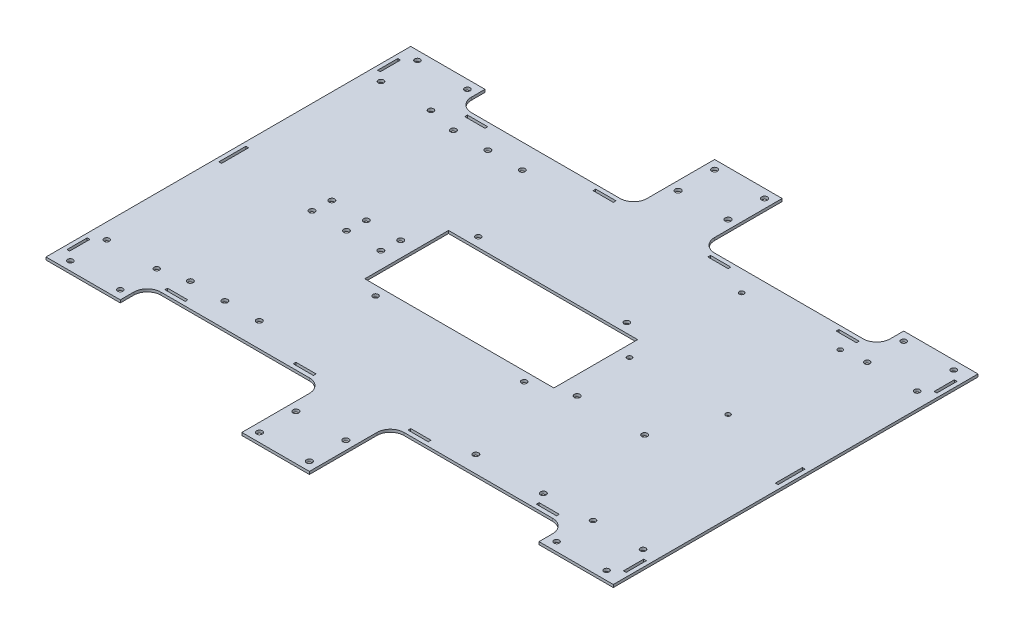
from build123d import *

# Parameters (mm, degrees)
SKETCH_1_R            = 2
SKETCH_1_R_2          = 2.15
EXTRUDE_1_DEPTH       = 2
CUT_EXTRUDE_1_DEPTH   = 274.366054952
MIRROR_2_COPY_1_DEPTH = 274.366054952
SKETCH_3_W            = 2
SKETCH_3_H            = 15
SKETCH_3_H_2          = 20
SKETCH_3_W_2          = 15
SKETCH_3_H_3          = 2
CUT_EXTRUDE_2_DEPTH   = 274.366054952
SKETCH_4_R            = 2.1
SKETCH_4_R_2          = 1.75
CUT_EXTRUDE_3_DEPTH   = 274.366054952
SKETCH_5_R            = 2
SKETCH_5_W            = 140
SKETCH_5_H            = 62
CUT_EXTRUDE_4_DEPTH   = 274.366054952


with BuildPart() as part:
    # 草图1 → 凸台-拉伸1 (new body)
    with BuildSketch(Plane(origin=(0, 0, 0), x_dir=(1, 0, 0), z_dir=(0, 1, 0))):
        Polygon((-210, -135), (-25, -135), (-25, -175), (25, -175), (25, -135), (210, -135), (210, 135), (25, 135), (25, 175), (-25, 175), (-25, 135), (-210, 135), align=None)
        with Locations((198.5, 128.5)):
            Circle(SKETCH_1_R, mode=Mode.SUBTRACT)
        with Locations((198.5, 101.5)):
            Circle(SKETCH_1_R, mode=Mode.SUBTRACT)
        with Locations((161.5, 101.5)):
            Circle(SKETCH_1_R, mode=Mode.SUBTRACT)
        with Locations((161.5, 128.5)):
            Circle(SKETCH_1_R, mode=Mode.SUBTRACT)
        with Locations((198.5, -128.5)):
            Circle(SKETCH_1_R, mode=Mode.SUBTRACT)
        with Locations((198.5, -101.5)):
            Circle(SKETCH_1_R, mode=Mode.SUBTRACT)
        with Locations((161.5, -101.5)):
            Circle(SKETCH_1_R, mode=Mode.SUBTRACT)
        with Locations((161.5, -128.5)):
            Circle(SKETCH_1_R, mode=Mode.SUBTRACT)
        with Locations((-161.5, 128.5)):
            Circle(SKETCH_1_R, mode=Mode.SUBTRACT)
        with Locations((-161.5, 101.5)):
            Circle(SKETCH_1_R, mode=Mode.SUBTRACT)
        with Locations((-198.5, 101.5)):
            Circle(SKETCH_1_R, mode=Mode.SUBTRACT)
        with Locations((-198.5, 128.5)):
            Circle(SKETCH_1_R, mode=Mode.SUBTRACT)
        with Locations((-161.5, -128.5)):
            Circle(SKETCH_1_R, mode=Mode.SUBTRACT)
        with Locations((-161.5, -101.5)):
            Circle(SKETCH_1_R, mode=Mode.SUBTRACT)
        with Locations((-198.5, -101.5)):
            Circle(SKETCH_1_R, mode=Mode.SUBTRACT)
        with Locations((-198.5, -128.5)):
            Circle(SKETCH_1_R, mode=Mode.SUBTRACT)
        with Locations((18.5, 168.5)):
            Circle(SKETCH_1_R_2, mode=Mode.SUBTRACT)
        with Locations((-18.5, 168.5)):
            Circle(SKETCH_1_R_2, mode=Mode.SUBTRACT)
        with Locations((-18.5, 141.5)):
            Circle(SKETCH_1_R_2, mode=Mode.SUBTRACT)
        with Locations((18.5, 141.5)):
            Circle(SKETCH_1_R_2, mode=Mode.SUBTRACT)
        with Locations((-18.5, -141.5)):
            Circle(SKETCH_1_R_2, mode=Mode.SUBTRACT)
        with Locations((18.5, -141.5)):
            Circle(SKETCH_1_R_2, mode=Mode.SUBTRACT)
        with Locations((18.5, -168.5)):
            Circle(SKETCH_1_R_2, mode=Mode.SUBTRACT)
        with Locations((-18.5, -168.5)):
            Circle(SKETCH_1_R_2, mode=Mode.SUBTRACT)
    extrude(amount=EXTRUDE_1_DEPTH)

    # 草图2 → 切除-拉伸1 (cut, through all)
    with BuildSketch(Plane(origin=(0, 2, 0), x_dir=(1, 0, 0), z_dir=(0, 1, 0))):
        with BuildLine():
            Line((-25, 135), (-155, 135))
            Line((-155, 135), (-155, 125))
            ThreePointArc((-155, 125), (-152.071067812, 117.928932188), (-145, 115))
            Line((-145, 115), (-35, 115))
            ThreePointArc((-35, 115), (-27.928932188, 117.928932188), (-25, 125))
            Line((-25, 125), (-25, 135))
        make_face()
    cut_extrude_1 = extrude(amount=-CUT_EXTRUDE_1_DEPTH, mode=Mode.SUBTRACT)

    # 镜向1: 切除-拉伸1 across plane
    add(cut_extrude_1.mirror(Plane.XY), mode=Mode.SUBTRACT)

    # 镜向2: 切除-拉伸1 across plane
    add(cut_extrude_1.mirror(Plane(origin=(0, 0, 0), x_dir=(0, 0, 1), z_dir=(1, 0, 0))), mode=Mode.SUBTRACT)

    # 镜向2 copy 1 sketch → 镜向2 copy 1 (cut, through all)
    with BuildSketch(Plane(origin=(0, 2, 0), x_dir=(-1, 0, 0), z_dir=(0, 1, 0))):
        with BuildLine():
            Line((-25, 135), (-155, 135))
            Line((-155, 135), (-155, 125))
            ThreePointArc((-155, 125), (-152.071067812, 117.928932188), (-145, 115))
            Line((-145, 115), (-35, 115))
            ThreePointArc((-35, 115), (-27.928932188, 117.928932188), (-25, 125))
            Line((-25, 125), (-25, 135))
        make_face()
    extrude(amount=-MIRROR_2_COPY_1_DEPTH, mode=Mode.SUBTRACT)

    # 草图3 → 切除-拉伸2 (cut, through all)
    with BuildSketch(Plane(origin=(0, 2, 0), x_dir=(1, 0, 0), z_dir=(0, 1, 0))):
        with Locations((-206, 115)):
            Rectangle(SKETCH_3_W, SKETCH_3_H)
        with Locations((-206, 0)):
            Rectangle(SKETCH_3_W, SKETCH_3_H_2)
        with Locations((-206, -115)):
            Rectangle(SKETCH_3_W, SKETCH_3_H)
        with Locations((206, -115)):
            Rectangle(SKETCH_3_W, SKETCH_3_H)
        with Locations((206, 0)):
            Rectangle(SKETCH_3_W, SKETCH_3_H_2)
        with Locations((206, 115)):
            Rectangle(SKETCH_3_W, SKETCH_3_H)
        with Locations((-137.5, 111)):
            Rectangle(SKETCH_3_W_2, SKETCH_3_H_3)
        with Locations((-42.5, 111)):
            Rectangle(SKETCH_3_W_2, SKETCH_3_H_3)
        with Locations((42.5, 111)):
            Rectangle(SKETCH_3_W_2, SKETCH_3_H_3)
        with Locations((137.5, 111)):
            Rectangle(SKETCH_3_W_2, SKETCH_3_H_3)
        with Locations((137.5, -111)):
            Rectangle(SKETCH_3_W_2, SKETCH_3_H_3)
        with Locations((42.5, -111)):
            Rectangle(SKETCH_3_W_2, SKETCH_3_H_3)
        with Locations((-42.5, -111)):
            Rectangle(SKETCH_3_W_2, SKETCH_3_H_3)
        with Locations((-137.5, -111)):
            Rectangle(SKETCH_3_W_2, SKETCH_3_H_3)
    extrude(amount=-CUT_EXTRUDE_2_DEPTH, mode=Mode.SUBTRACT)

    # 草图4 → 切除-拉伸3 (cut, through all)
    with BuildSketch(Plane(origin=(0, 2, 0), x_dir=(1, 0, 0), z_dir=(0, 1, 0))):
        with Locations((-141.1, -97)):
            Circle(SKETCH_4_R)
        with Locations((-115.6, -97)):
            Circle(SKETCH_4_R)
        with Locations((-90.1, -97)):
            Circle(SKETCH_4_R)
        with Locations((-90.1, -7)):
            Circle(SKETCH_4_R)
        with Locations((-115.6, -7)):
            Circle(SKETCH_4_R)
        with Locations((-141.1, -7)):
            Circle(SKETCH_4_R)
        with Locations((-140.4, 7)):
            Circle(SKETCH_4_R)
        with Locations((-114.9, 7)):
            Circle(SKETCH_4_R)
        with Locations((-89.4, 7)):
            Circle(SKETCH_4_R)
        with Locations((-89.4, 97)):
            Circle(SKETCH_4_R)
        with Locations((-114.9, 97)):
            Circle(SKETCH_4_R)
        with Locations((-140.4, 97)):
            Circle(SKETCH_4_R)
        with Locations((75.7, -27.5)):
            Circle(SKETCH_4_R)
        with Locations((125.7, -27.5)):
            Circle(SKETCH_4_R)
        with Locations((125.7, -102.5)):
            Circle(SKETCH_4_R)
        with Locations((75.7, -102.5)):
            Circle(SKETCH_4_R)
        with Locations((70.5, 99.5)):
            Circle(SKETCH_4_R_2)
        with Locations((143.5, 99.5)):
            Circle(SKETCH_4_R_2)
        with Locations((143.5, 16.5)):
            Circle(SKETCH_4_R_2)
        with Locations((70.5, 16.5)):
            Circle(SKETCH_4_R_2)
    extrude(amount=-CUT_EXTRUDE_3_DEPTH, mode=Mode.SUBTRACT)

    # 草图5 → 切除-拉伸4 (cut, through all)
    with BuildSketch(Plane.XZ):
        with Locations((-63, 38)):
            Circle(SKETCH_5_R)
        with Locations((47, 38)):
            Circle(SKETCH_5_R)
        with Locations((47, -38)):
            Circle(SKETCH_5_R)
        with Locations((-63, -38)):
            Circle(SKETCH_5_R)
        with Locations((-8, 0)):
            Rectangle(SKETCH_5_W, SKETCH_5_H)
    extrude(amount=-CUT_EXTRUDE_4_DEPTH, mode=Mode.SUBTRACT)


solid = part.part
